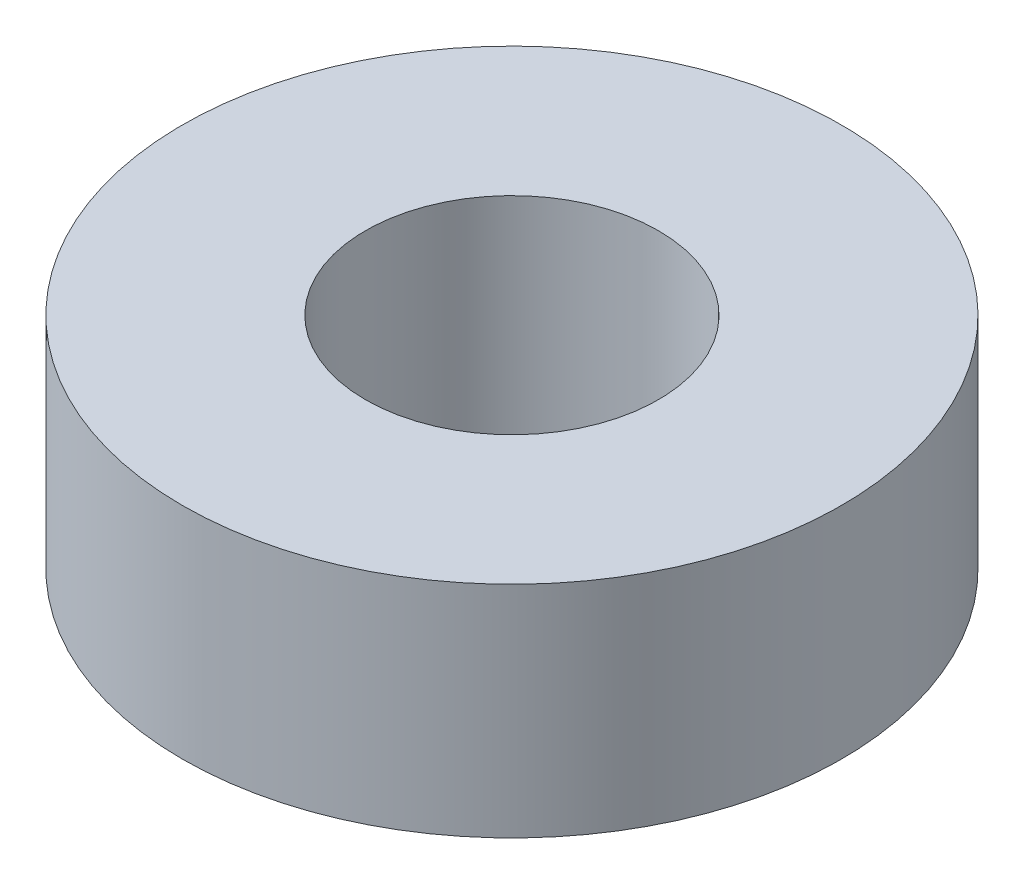
from build123d import *

# Parameters (mm, degrees)
SKETCH1_R               = 4.5
BOSS_EXTRUDE1_DEPTH     = 3
F_1_4_CLEARANCE_HOLE1_D = 4


with BuildPart() as part:
    # Sketch1 → Boss-Extrude1 (new body)
    with BuildSketch(Plane(origin=(0, 0, 0), x_dir=(1, 0, 0), z_dir=(0, 1, 0))):
        Circle(SKETCH1_R)
    extrude(amount=BOSS_EXTRUDE1_DEPTH)

    # 1/4 Clearance Hole1 (through all)
    with Locations(Plane(origin=(0, 3, 0), x_dir=(1, 0, 0), z_dir=(0, 1, 0))):
        with Locations((0, 0)):
            Hole(F_1_4_CLEARANCE_HOLE1_D / 2)


solid = part.part
